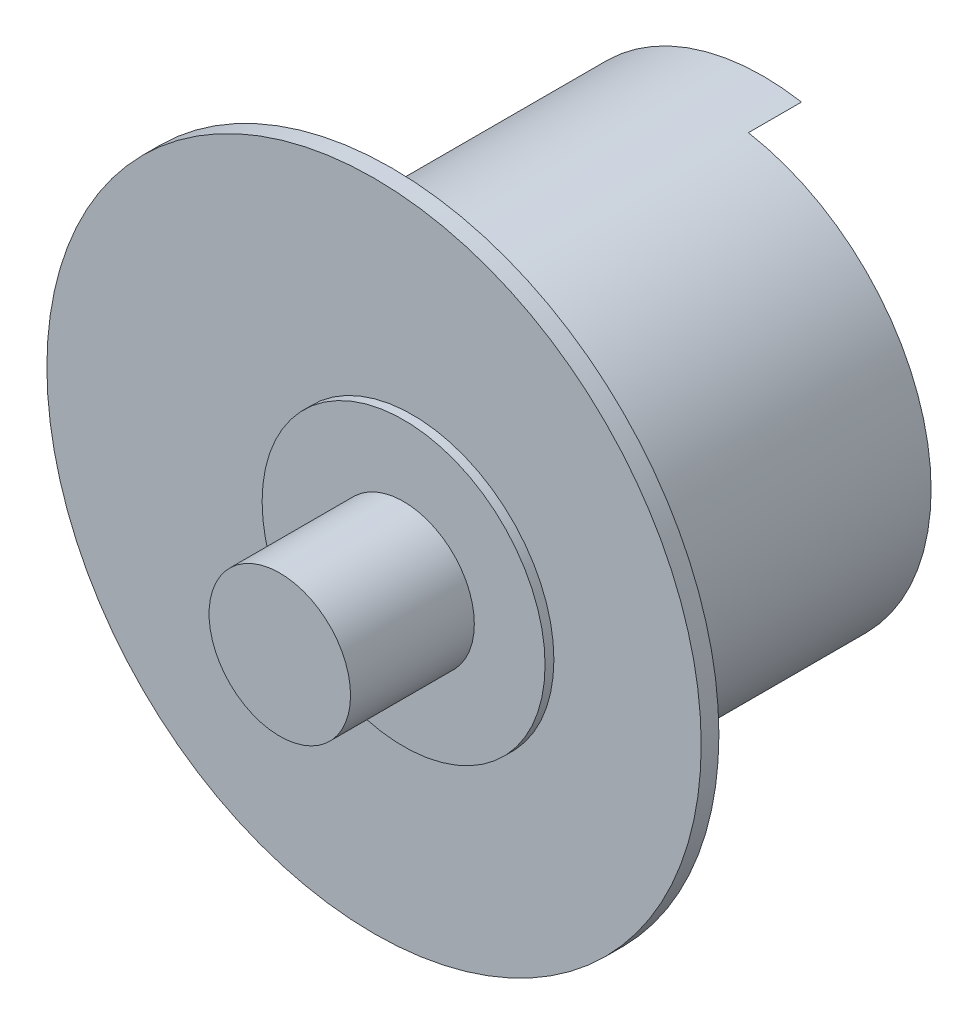
from build123d import *

# Parameters (mm, degrees)
SKETCH1_R           = 12.5
BOSS_EXTRUDE1_DEPTH = 13
SKETCH6_R           = 12.5
BOSS_EXTRUDE7_DEPTH = 5
SKETCH3_R           = 18.5
BOSS_EXTRUDE3_DEPTH = 1
SKETCH4_R           = 8
BOSS_EXTRUDE5_DEPTH = 0.5
SKETCH5_R           = 4
BOSS_EXTRUDE6_DEPTH = 7
BOSS_EXTRUDE8_START = 3
BOSS_EXTRUDE8_DEPTH = 3


with BuildPart() as part:
    # Sketch1 → Boss-Extrude1 (new body)
    with BuildSketch(Plane.XY):
        with Locations((-2.17, 0)):
            Circle(SKETCH1_R)
        Polygon((-4, 0), (-2, 3.464101615), (2, 3.464101615), (4, 0), (2, -3.464101615), (-2, -3.464101615), align=None, mode=Mode.SUBTRACT)
    extrude(amount=BOSS_EXTRUDE1_DEPTH)

    # Sketch6 → Boss-Extrude7 (add)
    with BuildSketch(Plane.XY.offset(13)):
        with Locations((-2.17, 0)):
            Circle(SKETCH6_R)
    extrude(amount=BOSS_EXTRUDE7_DEPTH)

    # Sketch3 → Boss-Extrude3 (add)
    with BuildSketch(Plane(origin=(0, 0, 18), x_dir=(-1, 0, 0), z_dir=(0, 0, -1))):
        with Locations((2.17, 0)):
            Circle(SKETCH3_R)
    extrude(amount=-BOSS_EXTRUDE3_DEPTH)

    # Sketch4 → Boss-Extrude5 (add)
    with BuildSketch(Plane.XY.offset(19)):
        Circle(SKETCH4_R)
    extrude(amount=BOSS_EXTRUDE5_DEPTH)

    # Sketch5 → Boss-Extrude6 (add)
    with BuildSketch(Plane.XY.offset(19.5)):
        Circle(SKETCH5_R)
    extrude(amount=BOSS_EXTRUDE6_DEPTH)

    # Sketch7 → Boss-Extrude8 (add)
    with BuildSketch(Plane(origin=(0, 0, 0), x_dir=(-1, 0, 0), z_dir=(0, 0, -1)).offset(BOSS_EXTRUDE8_START)):
        with BuildLine():
            ThreePointArc((0, -12.310203085), (10.20507934, -9.575359001), (14.67, 0))
            ThreePointArc((14.67, 0), (10.20507934, 9.575359001), (0, 12.310203085))
            ThreePointArc((0, 12.310203085), (10.33, 0), (0, -12.310203085))
        make_face()
    extrude(amount=-BOSS_EXTRUDE8_DEPTH)


solid = part.part
